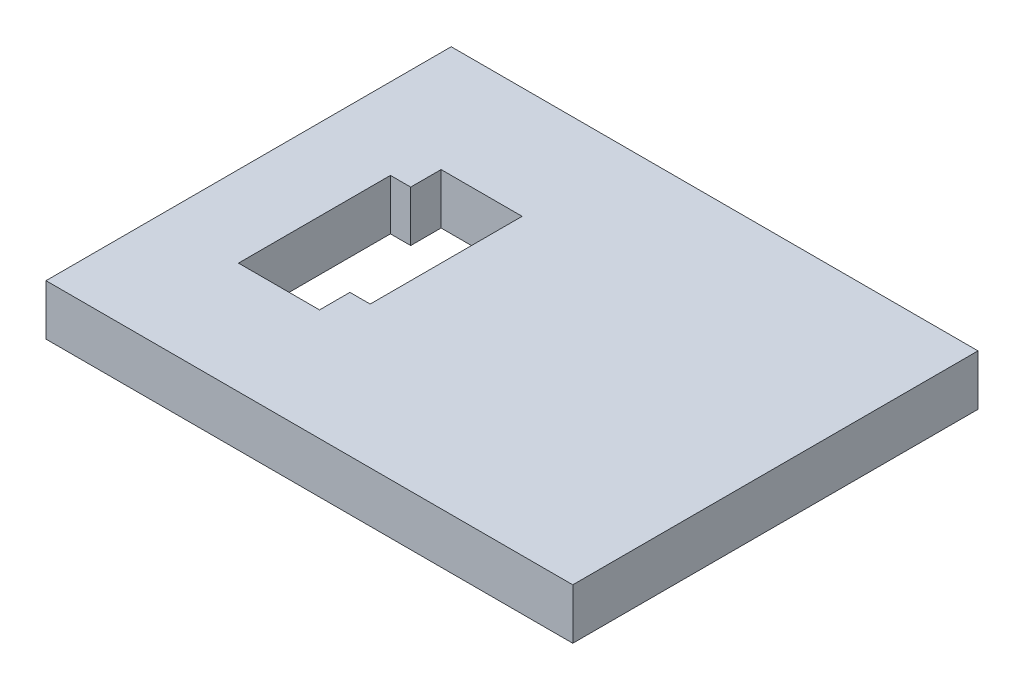
from build123d import *

# Parameters (mm, degrees)
STOCK_895_FRAME_1_START     = 74.5
STOCK_895_FRAME_1_OUTLINE_W = 50
STOCK_895_FRAME_1_OUTLINE_H = 40
STOCK_895_FRAME_1_DEPTH     = 5
SKETCH2_W                   = 5
SKETCH2_H                   = 40
BOSS_EXTRUDE1_DEPTH         = 2


# Read off the part's stored shape, not the designer's step: Stock-895_Frame-1
with BuildPart() as part:
    # Stock-895_Frame-1 outline → Stock-895_Frame-1 (new body)
    with BuildSketch(Plane(origin=(0, 0, 0), x_dir=(1, 0, 0), z_dir=(0, 1, 0)).offset(STOCK_895_FRAME_1_START)):
        with Locations((-25, 0)):
            Rectangle(STOCK_895_FRAME_1_OUTLINE_W, STOCK_895_FRAME_1_OUTLINE_H)
        Polygon((-34, -6), (-34, -9), (-42, -9), (-42, 6), (-40, 6), (-40, 9), (-32, 9), (-32, -6), align=None, mode=Mode.SUBTRACT)
    extrude(amount=STOCK_895_FRAME_1_DEPTH)

    # Sketch2 → Boss-Extrude1 (add)
    with BuildSketch(Plane.YZ):
        with Locations((77, 0)):
            Rectangle(SKETCH2_W, SKETCH2_H)
    extrude(amount=BOSS_EXTRUDE1_DEPTH)


solid = part.part
